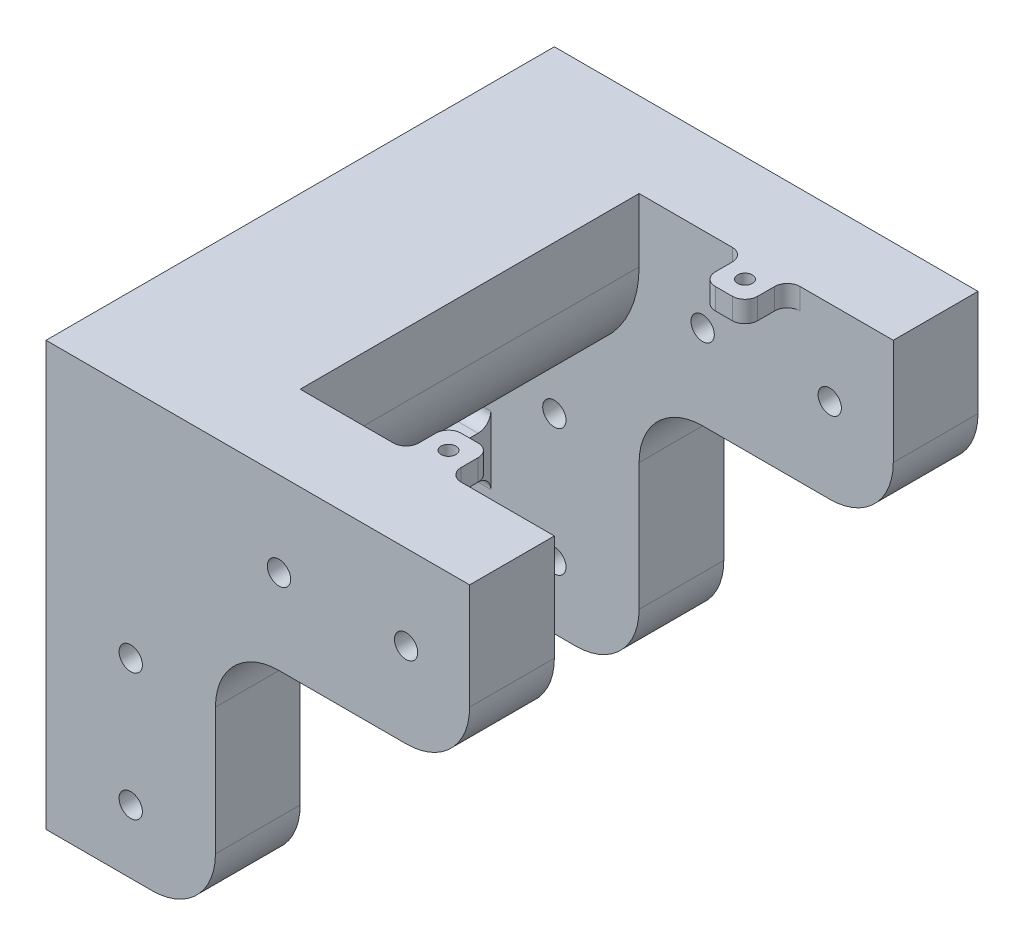
from build123d import *

# Parameters (mm, degrees)
BOSS_EXTRUDE1_DEPTH = 20
SKETCH2_W           = 40
SKETCH2_H           = 40
BOSS_EXTRUDE2_DEPTH = 80
SKETCH3_W           = 40
SKETCH3_H           = 60
SKETCH3_H_2         = 40
SKETCH3_W_2         = 60
BOSS_EXTRUDE3_DEPTH = 20
SKETCH5_R           = 2.75
CUT_EXTRUDE1_DEPTH  = 167
FILLET1_R           = 25
FILLET2_R           = 15
SKETCH6_W           = 5
SKETCH6_H           = 10
SKETCH6_W_2         = 10
SKETCH6_H_2         = 5
BOSS_EXTRUDE4_DEPTH = 10
CUT_EXTRUDE2_DEPTH  = 10
CUT_EXTRUDE3_DEPTH  = 10
SKETCH9_W           = 10
SKETCH9_H           = 5
SKETCH9_W_2         = 5
SKETCH9_H_2         = 10
BOSS_EXTRUDE5_DEPTH = 10
CUT_EXTRUDE4_DEPTH  = 10
CUT_EXTRUDE5_DEPTH  = 10
FILLET4_R           = 3


with BuildPart() as part:
    # Sketch1 → Boss-Extrude1 (new body)
    with BuildSketch(Plane.XY):
        Polygon((100, 380), (100, 340), (40, 340), (40, 280), (0, 280), (0, 380), align=None)
    extrude(amount=BOSS_EXTRUDE1_DEPTH)

    # Sketch2 → Boss-Extrude2 (add)
    with BuildSketch(Plane.XY.offset(20)):
        with Locations((20, 360)):
            Rectangle(SKETCH2_W, SKETCH2_H)
    extrude(amount=BOSS_EXTRUDE2_DEPTH)

    # Sketch3 → Boss-Extrude3 (add)
    with BuildSketch(Plane.XY.offset(100)):
        with Locations((20, 310)):
            Rectangle(SKETCH3_W, SKETCH3_H)
        with Locations((20, 360)):
            Rectangle(SKETCH3_W, SKETCH3_H_2)
        with Locations((70, 360)):
            Rectangle(SKETCH3_W_2, SKETCH3_H_2)
    extrude(amount=BOSS_EXTRUDE3_DEPTH)

    # Sketch5 → Cut-Extrude1 (cut)
    with BuildSketch(Plane.XY.offset(120)):
        with Locations((55, 360)):
            Circle(SKETCH5_R)
        with BuildLine():
            ThreePointArc((82.25, 360), (85, 357.25), (87.75, 360))
            Line((87.75, 360), (82.25, 360))
        make_face()
        with BuildLine():
            Line((82.25, 360), (87.75, 360))
            ThreePointArc((87.75, 360), (85, 362.75), (82.25, 360))
        make_face()
        with Locations((20, 325)):
            Circle(SKETCH5_R)
        with BuildLine():
            ThreePointArc((22.75, 295), (21.944543648, 296.944543648), (20, 297.75))
            Line((20, 297.75), (20, 292.25))
            ThreePointArc((20, 292.25), (21.944543648, 293.055456352), (22.75, 295))
        make_face()
        with BuildLine():
            Line((20, 292.25), (20, 297.75))
            ThreePointArc((20, 297.75), (17.25, 295), (20, 292.25))
        make_face()
    extrude(amount=-CUT_EXTRUDE1_DEPTH, mode=Mode.SUBTRACT)

    # Fillet1
    # the kernel refuses this fillet: 25 mm, written as the material it takes off along each edge
    with BuildSketch(Plane(origin=(40, 340, 20), x_dir=(0, 1, 0), z_dir=(0, 0, 1))) as fillet1_piece_1:
        with BuildLine():
            CenterArc((FILLET1_R, FILLET1_R), FILLET1_R, 180, 90)
            Line((0, FILLET1_R), (0, 0))
            Line((0, 0), (FILLET1_R, 0))
        make_face()
    extrude(amount=80, mode=Mode.SUBTRACT)

    # Fillet2
    fillet2_edges = [part.edges().sort_by_distance(p)[0] for p in [
        (100, 340, 10),
        (40, 340, 10),
        (40, 280, 10),
        (40, 280, 110),
        (40, 340, 110),
        (100, 340, 110),
    ]]
    fillet(fillet2_edges, radius=FILLET2_R)

    # Sketch6 → Boss-Extrude4 (add)
    with BuildSketch(Plane.XY.offset(20)):
        with Locations((2.5, 310)):
            Rectangle(SKETCH6_W, SKETCH6_H)
        with Locations((70, 377.5)):
            Rectangle(SKETCH6_W_2, SKETCH6_H_2)
    extrude(amount=BOSS_EXTRUDE4_DEPTH)

    # Sketch7 → Cut-Extrude2 (cut)
    with BuildSketch(Plane.XZ.offset(-375)):
        with BuildLine():
            ThreePointArc((71.75, 25), (71.237436867, 26.237436867), (70, 26.75))
            Line((70, 26.75), (70, 23.25))
            ThreePointArc((70, 23.25), (71.237436867, 23.762563133), (71.75, 25))
        make_face()
        with BuildLine():
            Line((70, 23.25), (70, 26.75))
            ThreePointArc((70, 26.75), (68.25, 25), (70, 23.25))
        make_face()
    extrude(amount=-CUT_EXTRUDE2_DEPTH, mode=Mode.SUBTRACT)

    # Sketch8 → Cut-Extrude3 (cut)
    with BuildSketch(Plane(origin=(5, 0, 0), x_dir=(0, 0, -1), z_dir=(1, 0, 0))):
        with BuildLine():
            ThreePointArc((-23.25, 310), (-25, 311.75), (-26.75, 310))
            Line((-26.75, 310), (-23.25, 310))
        make_face()
        with BuildLine():
            Line((-23.25, 310), (-26.75, 310))
            ThreePointArc((-26.75, 310), (-25, 308.25), (-23.25, 310))
        make_face()
    extrude(amount=-CUT_EXTRUDE3_DEPTH, mode=Mode.SUBTRACT)

    # Sketch9 → Boss-Extrude5 (add)
    with BuildSketch(Plane(origin=(0, 0, 100), x_dir=(-1, 0, 0), z_dir=(0, 0, -1))):
        with Locations((-70, 377.5)):
            Rectangle(SKETCH9_W, SKETCH9_H)
        with Locations((-2.5, 310)):
            Rectangle(SKETCH9_W_2, SKETCH9_H_2)
    extrude(amount=BOSS_EXTRUDE5_DEPTH)

    # Sketch10 → Cut-Extrude4 (cut)
    with BuildSketch(Plane(origin=(5, 0, 0), x_dir=(0, 0, -1), z_dir=(1, 0, 0))):
        with BuildLine():
            ThreePointArc((-96.75, 310), (-95, 308.25), (-93.25, 310))
            Line((-93.25, 310), (-96.75, 310))
        make_face()
        with BuildLine():
            Line((-96.75, 310), (-93.25, 310))
            ThreePointArc((-93.25, 310), (-95, 311.75), (-96.75, 310))
        make_face()
    extrude(amount=-CUT_EXTRUDE4_DEPTH, mode=Mode.SUBTRACT)

    # Sketch11 → Cut-Extrude5 (cut)
    with BuildSketch(Plane.XZ.offset(-375)):
        with BuildLine():
            ThreePointArc((71.75, 95), (71.237436867, 96.237436867), (70, 96.75))
            Line((70, 96.75), (70, 93.25))
            ThreePointArc((70, 93.25), (71.237436867, 93.762563133), (71.75, 95))
        make_face()
        with BuildLine():
            Line((70, 93.25), (70, 96.75))
            ThreePointArc((70, 96.75), (68.25, 95), (70, 93.25))
        make_face()
    extrude(amount=-CUT_EXTRUDE5_DEPTH, mode=Mode.SUBTRACT)

    # Fillet4
    fillet4_edges = [part.edges().sort_by_distance(p)[0] for p in [
        (2.5, 315, 30),
        (2.5, 305, 20),
        (2.5, 305, 30),
        (2.5, 315, 20),
        (75, 377.5, 30),
        (65, 377.5, 20),
        (65, 377.5, 30),
        (75, 377.5, 20),
        (65, 377.5, 100),
        (75, 377.5, 100),
        (65, 377.5, 90),
        (75, 377.5, 90),
        (2.5, 305, 100),
        (2.5, 315, 100),
        (2.5, 305, 90),
        (2.5, 315, 90),
    ]]
    fillet(fillet4_edges, radius=FILLET4_R)


solid = part.part
